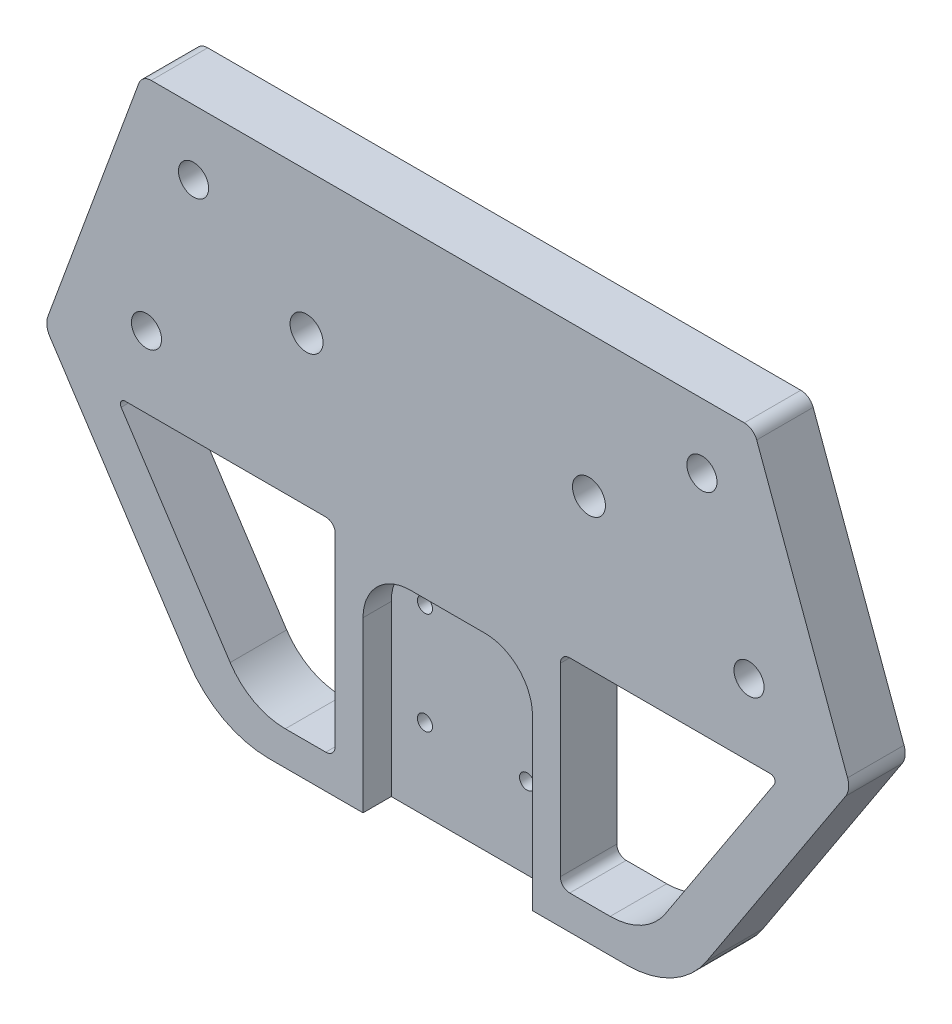
from build123d import *

# Parameters (mm, degrees)
SKETCH2_R               = 2.2225
BOSS_EXTRUDE1_DEPTH     = 7.62
CUT_EXTRUDE1_DEPTH      = 67.023858847
CUT_EXTRUDE1_DEPTH_BACK = 67.023858847
SKETCH3_R               = 1.016
CUT_EXTRUDE2_DEPTH      = 67.023858847
CUT_EXTRUDE2_DEPTH_BACK = 3.81
SKETCH5_R               = 1.905
CUT_EXTRUDE3_DEPTH      = 1.3335
CUT_EXTRUDE4_DEPTH      = 67.023858847
SKETCH8_R               = 2.032
CUT_EXTRUDE6_DEPTH      = 67.023858847
SKETCH9_R               = 3.937
CUT_EXTRUDE7_DEPTH      = 2.286


with BuildPart() as part:
    # Sketch2 → Boss-Extrude1 (new body)
    with BuildSketch(Plane.XY):
        with BuildLine():
            Line((-53.9331315, -0.315391152), (-41.673792668, 33.030010472))
            ThreePointArc((-41.673792668, 33.030010472), (-41.022456018, 33.874587748), (-40.005, 34.194483756))
            Line((-40.005, 34.194483756), (40.005, 34.194483756))
            ThreePointArc((40.005, 34.194483756), (41.022456018, 33.874587748), (41.673792668, 33.030010472))
            Line((41.673792668, 33.030010472), (53.9331315, -0.315391152))
            ThreePointArc((53.9331315, -0.315391152), (54.072783991, -1.479661595), (53.674573059, -2.582592481))
            Line((53.674573059, -2.582592481), (34.912039189, -31.25698725))
            ThreePointArc((34.912039189, -31.25698725), (30.258665327, -35.536214179), (24.13, -37.087063209))
            Line((24.13, -37.087063209), (-24.13, -37.087063209))
            ThreePointArc((-24.13, -37.087063209), (-30.258665327, -35.536214179), (-34.912039189, -31.25698725))
            Line((-34.912039189, -31.25698725), (-53.674573059, -2.582592481))
            ThreePointArc((-53.674573059, -2.582592481), (-54.072783991, -1.479661595), (-53.9331315, -0.315391152))
        make_face()
        with Locations((-19.05, 15.144483756)):
            Circle(SKETCH2_R, mode=Mode.SUBTRACT)
        with Locations((19.05, 15.144483756)):
            Circle(SKETCH2_R, mode=Mode.SUBTRACT)
    extrude(amount=BOSS_EXTRUDE1_DEPTH)

    # Sketch3 → Cut-Extrude1 (cut, two sides: drawn at the far end of the back side and taken through both)
    with BuildSketch(Plane.XY.offset(7.62).offset(-CUT_EXTRUDE1_DEPTH_BACK)):
        with Locations((-6.886956, -26.165063209)):
            Circle(SKETCH3_R)
        with Locations((-6.886956, -12.391151209)):
            Circle(SKETCH3_R)
        with Locations((6.886956, -12.391151209)):
            Circle(SKETCH3_R)
        with Locations((6.886956, -26.165063209)):
            Circle(SKETCH3_R)
    extrude(amount=CUT_EXTRUDE1_DEPTH + CUT_EXTRUDE1_DEPTH_BACK, mode=Mode.SUBTRACT)

    # Sketch4 → Cut-Extrude2 (cut, two sides: drawn at the far end of the back side and taken through both)
    with BuildSketch(Plane.XY.offset(7.62).offset(-CUT_EXTRUDE2_DEPTH_BACK)):
        with BuildLine():
            Line((5.018913292, -7.876319138), (-5.018913292, -7.876319138))
            ThreePointArc((-5.018913292, -7.876319138), (-9.552236178, -9.75408296), (-11.43, -14.287405846))
            Line((-11.43, -14.287405846), (-11.43, -37.721319138))
            Line((-11.43, -37.721319138), (11.43, -37.721319138))
            Line((11.43, -37.721319138), (11.43, -14.287405846))
            ThreePointArc((11.43, -14.287405846), (9.552236178, -9.75408296), (5.018913292, -7.876319138))
        make_face()
    extrude(amount=CUT_EXTRUDE2_DEPTH + CUT_EXTRUDE2_DEPTH_BACK, mode=Mode.SUBTRACT)

    # Sketch5 → Cut-Extrude3 (cut)
    with BuildSketch(Plane(origin=(0, 0, 0), x_dir=(-1, 0, 0), z_dir=(0, 0, -1))):
        with Locations((-6.886956, -12.391151209)):
            Circle(SKETCH5_R)
        with Locations((-6.886956, -26.165063209)):
            Circle(SKETCH5_R)
        with Locations((6.886956, -26.165063209)):
            Circle(SKETCH5_R)
        with Locations((6.886956, -12.391151209)):
            Circle(SKETCH5_R)
    extrude(amount=-CUT_EXTRUDE3_DEPTH, mode=Mode.SUBTRACT)

    # Sketch6 → Cut-Extrude4 (cut, through all)
    with BuildSketch(Plane.XY.offset(7.62)):
        with BuildLine():
            Line((-44.056637344, -6.015430746), (-29.353866797, -28.485372695))
            ThreePointArc((-29.353866797, -28.485372695), (-26.143297026, -31.437801842), (-21.914858001, -32.507801623))
            Line((-21.914858001, -32.507801623), (-16.452977044, -32.507801623))
            ThreePointArc((-16.452977044, -32.507801623), (-15.554951432, -32.135827235), (-15.182977044, -31.237801623))
            Line((-15.182977044, -31.237801623), (-15.182977044, -6.302747098))
            ThreePointArc((-15.182977044, -6.302747098), (-15.554951432, -5.404721486), (-16.452977044, -5.032747098))
            Line((-16.452977044, -5.032747098), (-43.525279573, -5.032747098))
            ThreePointArc((-43.525279573, -5.032747098), (-44.083851017, -5.365715739), (-44.056637344, -6.015430746))
        make_face()
        with BuildLine():
            Line((16.452977044, -32.507801623), (21.914858001, -32.507801623))
            ThreePointArc((21.914858001, -32.507801623), (26.143297026, -31.437801842), (29.353866797, -28.485372695))
            Line((29.353866797, -28.485372695), (44.056637344, -6.015430746))
            ThreePointArc((44.056637344, -6.015430746), (44.083851017, -5.365715739), (43.525279573, -5.032747098))
            Line((43.525279573, -5.032747098), (16.452977044, -5.032747098))
            ThreePointArc((16.452977044, -5.032747098), (15.554951432, -5.404721486), (15.182977044, -6.302747098))
            Line((15.182977044, -6.302747098), (15.182977044, -31.237801623))
            ThreePointArc((15.182977044, -31.237801623), (15.554951432, -32.135827235), (16.452977044, -32.507801623))
        make_face()
    extrude(amount=-CUT_EXTRUDE4_DEPTH, mode=Mode.SUBTRACT)

    # Sketch8 → Cut-Extrude6 (cut, through all)
    with BuildSketch(Plane.XY.offset(7.62)):
        with Locations((-40.64, 4.619252902)):
            Circle(SKETCH8_R)
        with Locations((-34.29, 25.447252902)):
            Circle(SKETCH8_R)
        with Locations((40.64, 4.619252902)):
            Circle(SKETCH8_R)
        with Locations((34.29, 25.447252902)):
            Circle(SKETCH8_R)
    extrude(amount=-CUT_EXTRUDE6_DEPTH, mode=Mode.SUBTRACT)

    # Sketch9 → Cut-Extrude7 (cut)
    with BuildSketch(Plane(origin=(0, 0, 0), x_dir=(-1, 0, 0), z_dir=(0, 0, -1))):
        with Locations((-19.05, 15.144483756)):
            Circle(SKETCH9_R)
        with Locations((19.05, 15.144483756)):
            Circle(SKETCH9_R)
    extrude(amount=-CUT_EXTRUDE7_DEPTH, mode=Mode.SUBTRACT)


solid = part.part
